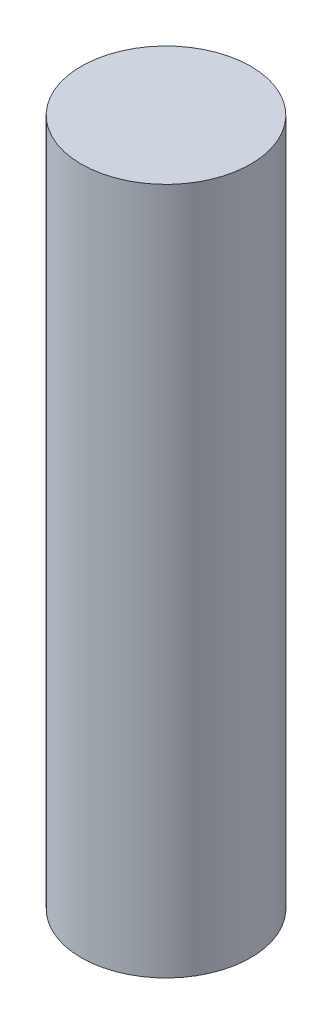
from build123d import *

# Parameters (mm, degrees)
SKETCH1_R           = 37
BOSS_EXTRUDE1_DEPTH = 300


with BuildPart() as part:
    # Sketch1 → Boss-Extrude1 (new body)
    with BuildSketch(Plane(origin=(0, 0, 0), x_dir=(1, 0, 0), z_dir=(0, 1, 0))):
        Circle(SKETCH1_R)
    extrude(amount=BOSS_EXTRUDE1_DEPTH)


solid = part.part
